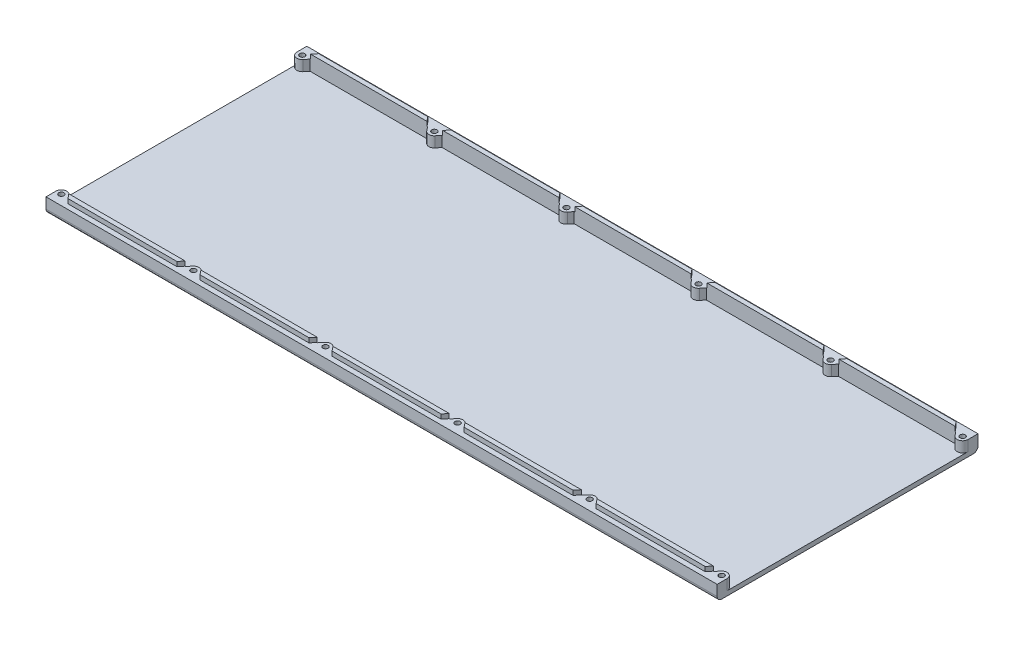
from build123d import *

# Parameters (mm, degrees)
BOSS_EXTRUDE1_DEPTH                     = 445
FILLET1_R                               = 3
BOSS_EXTRUDE2_DEPTH                     = 17.000001
CUT_EXTRUDE2_START                      = -10
CUT_EXTRUDE2_DEPTH                      = 10
CBORE_FOR_M6_HEX_HEAD_BOLT1_D           = 3.5
CBORE_FOR_M6_HEX_HEAD_BOLT1_CBORE_D     = 6.5
CBORE_FOR_M6_HEX_HEAD_BOLT1_CBORE_DEPTH = 4


# Read off the part's stored shape, not the designer's step: Cut-Extrude2
with BuildPart() as part:
    # Sketch1 → Boss-Extrude1 (new body)
    with BuildSketch(Plane.ZY.offset(329.974562358)):
        Polygon((-32.648970599, -10.219509128), (-32.648970599, -20.219509128), (140.305001839, -20.219509128), (140.305001839, -10.219509128), (137.305001839, -10.219509128), (137.005001839, -10.219509128), (137.005001839, -7.219509128), (134.005001839, -7.219509128), (134.005001839, -17.219509128), (-26.348970599, -17.219509128), (-26.348970599, -7.219509128), (-29.348970599, -7.219509128), (-29.348970599, -10.219509128), (-29.648970599, -10.219509128), align=None)
    extrude(amount=-BOSS_EXTRUDE1_DEPTH)

    # Fillet1
    fillet1_edges = [part.edges().sort_by_distance(p)[0] for p in [
        (-107.474562358, -20.219509128, 140.305001839),
        (-107.474562358, -20.219509128, -32.648970599),
    ]]
    fillet(fillet1_edges, radius=FILLET1_R)

    # Sketch2 → Boss-Extrude2 (add)
    with BuildSketch(Plane(origin=(0, -0.219509128, 0), x_dir=(1, 0, 0), z_dir=(0, 1, 0))):
        with BuildLine():
            Line((-231.322172227, -137.305001839), (-236.004916059, -131.454249149))
            ThreePointArc((-236.004916059, -131.454249149), (-238.814562358, -130.105001839), (-241.624208658, -131.454249149))
            Line((-241.624208658, -131.454249149), (-246.30695249, -137.305001839))
            Line((-246.30695249, -137.305001839), (-318.882172227, -137.305001839))
            Line((-318.882172227, -137.305001839), (-329.974562358, -137.305001839))
            Line((-329.974562358, -137.305001839), (-329.974562358, -140.305001839))
            Line((-329.974562358, -140.305001839), (115.025437642, -140.305001839))
            Line((115.025437642, -140.305001839), (115.025437642, -137.305001839))
            Line((115.025437642, -137.305001839), (115.025437642, -133.705001839))
            ThreePointArc((115.025437642, -133.705001839), (112.618180976, -130.308332391), (108.615791342, -131.454249149))
            Line((108.615791342, -131.454249149), (103.93304751, -137.305001839))
            Line((103.93304751, -137.305001839), (31.357827773, -137.305001839))
            Line((31.357827773, -137.305001839), (26.675083941, -131.454249149))
            ThreePointArc((26.675083941, -131.454249149), (23.865437642, -130.105001839), (21.055791342, -131.454249149))
            Line((21.055791342, -131.454249149), (16.37304751, -137.305001839))
            Line((16.37304751, -137.305001839), (-56.202172227, -137.305001839))
            Line((-56.202172227, -137.305001839), (-60.884916059, -131.454249149))
            ThreePointArc((-60.884916059, -131.454249149), (-63.694562358, -130.105001839), (-66.504208658, -131.454249149))
            Line((-66.504208658, -131.454249149), (-71.18695249, -137.305001839))
            Line((-71.18695249, -137.305001839), (-143.762172227, -137.305001839))
            Line((-143.762172227, -137.305001839), (-148.444916059, -131.454249148))
            ThreePointArc((-148.444916059, -131.454249148), (-151.254562358, -130.105001839), (-154.064208658, -131.454249149))
            Line((-154.064208658, -131.454249149), (-158.74695249, -137.305001839))
            Line((-158.74695249, -137.305001839), (-231.322172227, -137.305001839))
        make_face()
        with BuildLine():
            Line((-329.974562358, 29.648970599), (-329.974562358, 26.048970599))
            ThreePointArc((-329.974562358, 26.048970599), (-327.567305693, 22.652301151), (-323.564916059, 23.798217909))
            Line((-323.564916059, 23.798217909), (-318.882172227, 29.648970599))
            Line((-318.882172227, 29.648970599), (-246.30695249, 29.648970599))
            Line((-246.30695249, 29.648970599), (-241.624208658, 23.798217909))
            ThreePointArc((-241.624208658, 23.798217909), (-238.814562358, 22.448970599), (-236.004916059, 23.798217909))
            Line((-236.004916059, 23.798217909), (-231.322172227, 29.648970599))
            Line((-231.322172227, 29.648970599), (-158.74695249, 29.648970599))
            Line((-158.74695249, 29.648970599), (-154.064208658, 23.798217909))
            ThreePointArc((-154.064208658, 23.798217909), (-151.254562358, 22.448970599), (-148.444916059, 23.798217909))
            Line((-148.444916059, 23.798217909), (-143.762172227, 29.648970599))
            Line((-143.762172227, 29.648970599), (-71.18695249, 29.648970599))
            Line((-71.18695249, 29.648970599), (-66.504208658, 23.798217909))
            ThreePointArc((-66.504208658, 23.798217909), (-63.694562358, 22.448970599), (-60.884916059, 23.798217909))
            Line((-60.884916059, 23.798217909), (-56.202172227, 29.648970599))
            Line((-56.202172227, 29.648970599), (16.37304751, 29.648970599))
            Line((16.37304751, 29.648970599), (21.055791342, 23.798217909))
            ThreePointArc((21.055791342, 23.798217909), (23.865437642, 22.448970599), (26.675083941, 23.798217909))
            Line((26.675083941, 23.798217909), (31.357827773, 29.648970599))
            Line((31.357827773, 29.648970599), (103.93304751, 29.648970599))
            Line((103.93304751, 29.648970599), (108.615791342, 23.798217909))
            ThreePointArc((108.615791342, 23.798217909), (112.618180976, 22.652301151), (115.025437642, 26.048970599))
            Line((115.025437642, 26.048970599), (115.025437642, 32.648970599))
            Line((115.025437642, 32.648970599), (-329.974562358, 32.648970599))
            Line((-329.974562358, 32.648970599), (-329.974562358, 29.648970599))
        make_face()
        with BuildLine():
            Line((-329.974562358, -133.705001839), (-329.974562358, -137.305001839))
            Line((-329.974562358, -137.305001839), (-318.882172227, -137.305001839))
            Line((-318.882172227, -137.305001839), (-323.564916059, -131.454249149))
            ThreePointArc((-323.564916059, -131.454249149), (-327.567305693, -130.308332391), (-329.974562358, -133.705001839))
        make_face()
    extrude(amount=-BOSS_EXTRUDE2_DEPTH)

    # Cut-Extrude2 outline → Cut-Extrude2 (cut)
    with BuildSketch(Plane(origin=(0, -0.219509128, 0), x_dir=(1, 0, 0), z_dir=(0, 1, 0)).offset(CUT_EXTRUDE2_START)):
        with BuildLine():
            Line((-319.122282043, -137.005001839), (-318.738025977, -137.005001839))
            Line((-318.738025977, -137.005001839), (-321.139124143, -134.005001839))
            Line((-321.139124143, -134.005001839), (-321.523380199, -134.005001839))
            Line((-321.523380199, -134.005001839), (-323.564916059, -131.454249149))
            ThreePointArc((-323.564916059, -131.454249149), (-327.567305692, -130.308332391), (-329.974562358, -133.705001839))
            Line((-329.974562358, -133.705001839), (-329.974562358, -140.305001839))
            Line((-329.974562358, -140.305001839), (115.025437642, -140.305001839))
            Line((115.025437642, -140.305001839), (115.025437642, -133.705001839))
            ThreePointArc((115.025437642, -133.705001839), (112.618180976, -130.308332391), (108.615791342, -131.454249149))
            Line((108.615791342, -131.454249149), (106.574255482, -134.005001839))
            Line((106.574255482, -134.005001839), (106.189999426, -134.005001839))
            Line((106.189999426, -134.005001839), (103.788901261, -137.005001839))
            Line((103.788901261, -137.005001839), (104.173157326, -137.005001839))
            Line((104.173157326, -137.005001839), (103.93304751, -137.305001839))
            Line((103.93304751, -137.305001839), (31.357827773, -137.305001839))
            Line((31.357827773, -137.305001839), (31.117717957, -137.005001839))
            Line((31.117717957, -137.005001839), (31.501974023, -137.005001839))
            Line((31.501974023, -137.005001839), (29.100875857, -134.005001839))
            Line((29.100875857, -134.005001839), (28.716619801, -134.005001839))
            Line((28.716619801, -134.005001839), (26.675083941, -131.454249149))
            ThreePointArc((26.675083941, -131.454249149), (23.865437641, -130.105001839), (21.055791342, -131.454249149))
            Line((21.055791342, -131.454249149), (19.014255482, -134.005001839))
            Line((19.014255482, -134.005001839), (18.629999426, -134.005001839))
            Line((18.629999426, -134.005001839), (16.228901261, -137.005001839))
            Line((16.228901261, -137.005001839), (16.613157326, -137.005001839))
            Line((16.613157326, -137.005001839), (16.37304751, -137.305001839))
            Line((16.37304751, -137.305001839), (-56.202172227, -137.305001839))
            Line((-56.202172227, -137.305001839), (-56.442282043, -137.005001839))
            Line((-56.442282043, -137.005001839), (-56.058025977, -137.005001839))
            Line((-56.058025977, -137.005001839), (-58.459124143, -134.005001839))
            Line((-58.459124143, -134.005001839), (-58.843380199, -134.005001839))
            Line((-58.843380199, -134.005001839), (-60.884916059, -131.454249149))
            ThreePointArc((-60.884916059, -131.454249149), (-63.694562358, -130.105001839), (-66.504208658, -131.454249149))
            Line((-66.504208658, -131.454249149), (-68.545744518, -134.005001839))
            Line((-68.545744518, -134.005001839), (-68.930000574, -134.005001839))
            Line((-68.930000574, -134.005001839), (-71.331098739, -137.005001839))
            Line((-71.331098739, -137.005001839), (-70.946842674, -137.005001839))
            Line((-70.946842674, -137.005001839), (-71.18695249, -137.305001839))
            Line((-71.18695249, -137.305001839), (-143.762172227, -137.305001839))
            Line((-143.762172227, -137.305001839), (-144.002282043, -137.005001839))
            Line((-144.002282043, -137.005001839), (-143.618025977, -137.005001839))
            Line((-143.618025977, -137.005001839), (-146.019124143, -134.005001839))
            Line((-146.019124143, -134.005001839), (-146.403380199, -134.005001839))
            Line((-146.403380199, -134.005001839), (-148.444916059, -131.454249149))
            ThreePointArc((-148.444916059, -131.454249149), (-151.254562359, -130.105001839), (-154.064208658, -131.454249149))
            Line((-154.064208658, -131.454249149), (-156.105744518, -134.005001839))
            Line((-156.105744518, -134.005001839), (-156.490000574, -134.005001839))
            Line((-156.490000574, -134.005001839), (-158.891098739, -137.005001839))
            Line((-158.891098739, -137.005001839), (-158.506842674, -137.005001839))
            Line((-158.506842674, -137.005001839), (-158.74695249, -137.305001839))
            Line((-158.74695249, -137.305001839), (-231.322172227, -137.305001839))
            Line((-231.322172227, -137.305001839), (-231.562282043, -137.005001839))
            Line((-231.562282043, -137.005001839), (-231.178025977, -137.005001839))
            Line((-231.178025977, -137.005001839), (-233.579124143, -134.005001839))
            Line((-233.579124143, -134.005001839), (-233.963380199, -134.005001839))
            Line((-233.963380199, -134.005001839), (-236.004916059, -131.454249149))
            ThreePointArc((-236.004916059, -131.454249149), (-238.814562359, -130.105001839), (-241.624208658, -131.454249149))
            Line((-241.624208658, -131.454249149), (-243.665744518, -134.005001839))
            Line((-243.665744518, -134.005001839), (-244.050000574, -134.005001839))
            Line((-244.050000574, -134.005001839), (-246.451098739, -137.005001839))
            Line((-246.451098739, -137.005001839), (-246.066842674, -137.005001839))
            Line((-246.066842674, -137.005001839), (-246.30695249, -137.305001839))
            Line((-246.30695249, -137.305001839), (-318.882172227, -137.305001839))
            Line((-318.882172227, -137.305001839), (-319.122282043, -137.005001839))
        make_face()
        with BuildLine():
            Line((-329.974562358, 32.648970599), (-329.974562358, 26.048970599))
            ThreePointArc((-329.974562358, 26.048970599), (-327.567305692, 22.652301151), (-323.564916059, 23.798217909))
            Line((-323.564916059, 23.798217909), (-321.523380199, 26.348970599))
            Line((-321.523380199, 26.348970599), (-321.139124143, 26.348970599))
            Line((-321.139124143, 26.348970599), (-318.738025977, 29.348970599))
            Line((-318.738025977, 29.348970599), (-319.122282043, 29.348970599))
            Line((-319.122282043, 29.348970599), (-318.882172227, 29.648970599))
            Line((-318.882172227, 29.648970599), (-246.30695249, 29.648970599))
            Line((-246.30695249, 29.648970599), (-246.066842674, 29.348970599))
            Line((-246.066842674, 29.348970599), (-246.451098739, 29.348970599))
            Line((-246.451098739, 29.348970599), (-244.050000574, 26.348970599))
            Line((-244.050000574, 26.348970599), (-243.665744518, 26.348970599))
            Line((-243.665744518, 26.348970599), (-241.624208658, 23.798217909))
            ThreePointArc((-241.624208658, 23.798217909), (-238.814562359, 22.448970599), (-236.004916059, 23.798217909))
            Line((-236.004916059, 23.798217909), (-233.963380199, 26.348970599))
            Line((-233.963380199, 26.348970599), (-233.579124143, 26.348970599))
            Line((-233.579124143, 26.348970599), (-231.178025977, 29.348970599))
            Line((-231.178025977, 29.348970599), (-231.562282043, 29.348970599))
            Line((-231.562282043, 29.348970599), (-231.322172227, 29.648970599))
            Line((-231.322172227, 29.648970599), (-158.74695249, 29.648970599))
            Line((-158.74695249, 29.648970599), (-158.506842674, 29.348970599))
            Line((-158.506842674, 29.348970599), (-158.891098739, 29.348970599))
            Line((-158.891098739, 29.348970599), (-156.490000574, 26.348970599))
            Line((-156.490000574, 26.348970599), (-156.105744518, 26.348970599))
            Line((-156.105744518, 26.348970599), (-154.064208658, 23.798217909))
            ThreePointArc((-154.064208658, 23.798217909), (-151.254562359, 22.448970599), (-148.444916059, 23.798217909))
            Line((-148.444916059, 23.798217909), (-146.403380199, 26.348970599))
            Line((-146.403380199, 26.348970599), (-146.019124143, 26.348970599))
            Line((-146.019124143, 26.348970599), (-143.618025977, 29.348970599))
            Line((-143.618025977, 29.348970599), (-144.002282043, 29.348970599))
            Line((-144.002282043, 29.348970599), (-143.762172227, 29.648970599))
            Line((-143.762172227, 29.648970599), (-71.18695249, 29.648970599))
            Line((-71.18695249, 29.648970599), (-70.946842674, 29.348970599))
            Line((-70.946842674, 29.348970599), (-71.331098739, 29.348970599))
            Line((-71.331098739, 29.348970599), (-68.930000574, 26.348970599))
            Line((-68.930000574, 26.348970599), (-68.545744518, 26.348970599))
            Line((-68.545744518, 26.348970599), (-66.504208658, 23.798217909))
            ThreePointArc((-66.504208658, 23.798217909), (-63.694562358, 22.448970599), (-60.884916059, 23.798217909))
            Line((-60.884916059, 23.798217909), (-58.843380199, 26.348970599))
            Line((-58.843380199, 26.348970599), (-58.459124143, 26.348970599))
            Line((-58.459124143, 26.348970599), (-56.058025977, 29.348970599))
            Line((-56.058025977, 29.348970599), (-56.442282043, 29.348970599))
            Line((-56.442282043, 29.348970599), (-56.202172227, 29.648970599))
            Line((-56.202172227, 29.648970599), (16.37304751, 29.648970599))
            Line((16.37304751, 29.648970599), (16.613157326, 29.348970599))
            Line((16.613157326, 29.348970599), (16.228901261, 29.348970599))
            Line((16.228901261, 29.348970599), (18.629999426, 26.348970599))
            Line((18.629999426, 26.348970599), (19.014255482, 26.348970599))
            Line((19.014255482, 26.348970599), (21.055791342, 23.798217909))
            ThreePointArc((21.055791342, 23.798217909), (23.865437641, 22.448970599), (26.675083941, 23.798217909))
            Line((26.675083941, 23.798217909), (28.716619801, 26.348970599))
            Line((28.716619801, 26.348970599), (29.100875857, 26.348970599))
            Line((29.100875857, 26.348970599), (31.501974023, 29.348970599))
            Line((31.501974023, 29.348970599), (31.117717957, 29.348970599))
            Line((31.117717957, 29.348970599), (31.357827773, 29.648970599))
            Line((31.357827773, 29.648970599), (103.93304751, 29.648970599))
            Line((103.93304751, 29.648970599), (104.173157326, 29.348970599))
            Line((104.173157326, 29.348970599), (103.788901261, 29.348970599))
            Line((103.788901261, 29.348970599), (106.189999426, 26.348970599))
            Line((106.189999426, 26.348970599), (106.574255482, 26.348970599))
            Line((106.574255482, 26.348970599), (108.615791342, 23.798217909))
            ThreePointArc((108.615791342, 23.798217909), (112.618180976, 22.652301151), (115.025437642, 26.048970599))
            Line((115.025437642, 26.048970599), (115.025437642, 32.648970599))
            Line((115.025437642, 32.648970599), (-329.974562358, 32.648970599))
        make_face()
    extrude(amount=CUT_EXTRUDE2_DEPTH, mode=Mode.SUBTRACT)

    # CBORE for M6 Hex Head Bolt1 (through all)
    with Locations(Plane(origin=(0, -20.219509128, 0), x_dir=(-1, 0, 0), z_dir=(0, -1, 0))):
        with Locations((326.374562358, -133.705001839), (238.814562358, -133.705001839), (151.254562358, -133.705001839), (63.694562358, -133.705001839), (-23.865437642, -133.705001839), (-111.425437642, -133.705001839), (-111.425437642, 26.048970599), (-23.865437642, 26.048970599), (63.694562358, 26.048970599), (151.254562358, 26.048970599), (238.814562358, 26.048970599), (326.374562358, 26.048970599)):
            CounterBoreHole(CBORE_FOR_M6_HEX_HEAD_BOLT1_D / 2, CBORE_FOR_M6_HEX_HEAD_BOLT1_CBORE_D / 2, CBORE_FOR_M6_HEX_HEAD_BOLT1_CBORE_DEPTH)


solid = part.part
